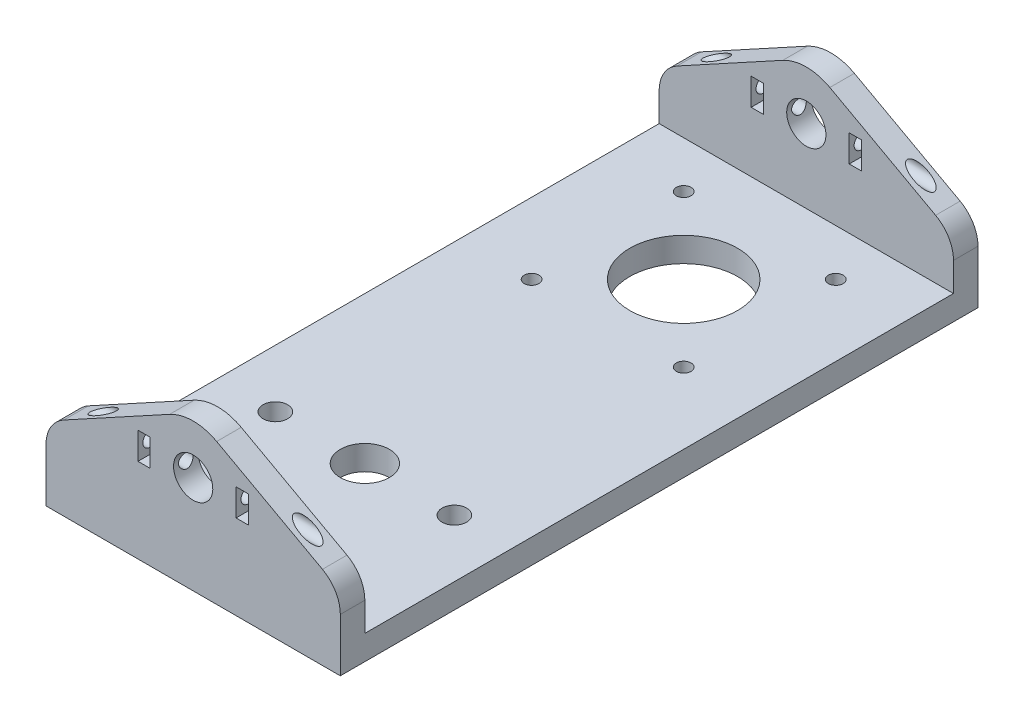
from build123d import *
from OCP.BRepAlgoAPI import BRepAlgoAPI_Cut
from OCP.TopTools import TopTools_ListOfShape

# Parameters (mm, degrees)
BOSS_EXTRUDE1_DEPTH    = 60
CUT_EXTRUDE1_START     = -130
CUT_EXTRUDE1_OUTLINE_R = 4
CUT_EXTRUDE1_OUTLINE_W = 2.5
CUT_EXTRUDE1_OUTLINE_H = 5.5
CUT_EXTRUDE1_DEPTH     = 130
CUT_EXTRUDE2_REACH     = 93.924
SKETCH3_R              = 11
SKETCH3_R_2            = 1.5
SKETCH3_R_3            = 5
SKETCH3_R_4            = 2.5
SKETCH4_R              = 1.5
CUT_EXTRUDE3_DEPTH     = 94.407708115


with BuildPart() as part:
    # Sketch1 → Boss-Extrude1 (new body)
    with BuildSketch(Plane(origin=(0, 0, 0), x_dir=(0, 0, -1), z_dir=(1, 0, 0))):
        Polygon((-65, 0), (65, 0), (65, 30), (60, 30), (60, 5), (-60, 5), (-60, 30), (-65, 30), align=None)
    extrude(amount=BOSS_EXTRUDE1_DEPTH)


with BuildPart() as cut_extrude1_tool:
    # Cut-Extrude1: read off the stored shape, not the designer's step
    # Cut-Extrude1 outline → Cut-Extrude1 (new body)
    with BuildSketch(Plane(origin=(0, 0, -65), x_dir=(-1, 0, 0), z_dir=(0, 0, -1)).offset(CUT_EXTRUDE1_START)):
        with BuildLine():
            Line((0, 30), (-30, 29.999998923))
            ThreePointArc((-30, 29.999998923), (-27.525092827, 29.688901535), (-25.204173103, 28.774965689))
            Line((-25.204173103, 28.774965689), (-3.642920811, 16.99098415))
            ThreePointArc((-3.642920811, 16.99098415), (-0.979221216, 14.419252925), (0, 10.848507507))
            Line((0, 10.848507507), (0, 30))
        make_face()
        with BuildLine():
            ThreePointArc((-60, 10.848507507), (-59.020778784, 14.419252925), (-56.357079189, 16.99098415))
            Line((-56.357079189, 16.99098415), (-34.795826897, 28.774965689))
            ThreePointArc((-34.795826897, 28.774965689), (-32.474907173, 29.688901535), (-30, 29.999998923))
            Line((-30, 29.999998923), (-60, 30))
            Line((-60, 30), (-60, 10.848507507))
        make_face()
        with Locations((-30, 20)):
            Circle(CUT_EXTRUDE1_OUTLINE_R)
        with Locations((-20, 20)):
            Rectangle(CUT_EXTRUDE1_OUTLINE_W, CUT_EXTRUDE1_OUTLINE_H)
        with Locations((-40, 20)):
            Rectangle(CUT_EXTRUDE1_OUTLINE_W, CUT_EXTRUDE1_OUTLINE_H)
    extrude(amount=CUT_EXTRUDE1_DEPTH)


with BuildPart() as part_1:
    add(part.part)

    # Cut-Extrude1: cut by cut_extrude1_tool, with a tolerance
    cut_extrude1_stock = TopTools_ListOfShape()
    cut_extrude1_stock.Append(part_1.part.wrapped)
    cut_extrude1_tools = TopTools_ListOfShape()
    cut_extrude1_tools.Append(cut_extrude1_tool.part.wrapped)
    cut_extrude1_cut = BRepAlgoAPI_Cut()
    cut_extrude1_cut.SetArguments(cut_extrude1_stock)
    cut_extrude1_cut.SetTools(cut_extrude1_tools)
    cut_extrude1_cut.SetFuzzyValue(0.00001)
    cut_extrude1_cut.Build()
    add(Compound.cast(cut_extrude1_cut.Shape()).solids(), mode=Mode.REPLACE)

    # Sketch3 → Cut-Extrude2 (cut, up to next)
    with BuildSketch(Plane(origin=(0, 5, 0), x_dir=(1, 0, 0), z_dir=(0, 1, 0)), mode=Mode.PRIVATE) as cut_extrude2_sk1:
        with Locations(Location((30, 35, 0), (0, 0, 270))):
            Circle(SKETCH3_R)
    cut_extrude2_tool1 = extrude(cut_extrude2_sk1.sketch, amount=-CUT_EXTRUDE2_REACH, mode=Mode.PRIVATE) & part_1.part
    # Sketch3 → Cut-Extrude2 (cut, up to next)
    with BuildSketch(Plane(origin=(0, 5, 0), x_dir=(1, 0, 0), z_dir=(0, 1, 0)), mode=Mode.PRIVATE) as cut_extrude2_sk2:
        with Locations(Location((45.5, 19.5, 0), (0, 0, 270))):
            Circle(SKETCH3_R_2)
    cut_extrude2_tool2 = extrude(cut_extrude2_sk2.sketch, amount=-CUT_EXTRUDE2_REACH, mode=Mode.PRIVATE) & part_1.part
    # Sketch3 → Cut-Extrude2 (cut, up to next)
    with BuildSketch(Plane(origin=(0, 5, 0), x_dir=(1, 0, 0), z_dir=(0, 1, 0)), mode=Mode.PRIVATE) as cut_extrude2_sk3:
        with Locations(Location((45.5, 50.5, 0), (0, 0, 270))):
            Circle(SKETCH3_R_2)
    cut_extrude2_tool3 = extrude(cut_extrude2_sk3.sketch, amount=-CUT_EXTRUDE2_REACH, mode=Mode.PRIVATE) & part_1.part
    # Sketch3 → Cut-Extrude2 (cut, up to next)
    with BuildSketch(Plane(origin=(0, 5, 0), x_dir=(1, 0, 0), z_dir=(0, 1, 0)), mode=Mode.PRIVATE) as cut_extrude2_sk4:
        with Locations(Location((14.5, 50.5, 0), (0, 0, 270))):
            Circle(SKETCH3_R_2)
    cut_extrude2_tool4 = extrude(cut_extrude2_sk4.sketch, amount=-CUT_EXTRUDE2_REACH, mode=Mode.PRIVATE) & part_1.part
    # Sketch3 → Cut-Extrude2 (cut, up to next)
    with BuildSketch(Plane(origin=(0, 5, 0), x_dir=(1, 0, 0), z_dir=(0, 1, 0)), mode=Mode.PRIVATE) as cut_extrude2_sk5:
        with Locations(Location((14.5, 19.5, 0), (0, 0, 270))):
            Circle(SKETCH3_R_2)
    cut_extrude2_tool5 = extrude(cut_extrude2_sk5.sketch, amount=-CUT_EXTRUDE2_REACH, mode=Mode.PRIVATE) & part_1.part
    # Sketch3 → Cut-Extrude2 (cut, up to next)
    with BuildSketch(Plane(origin=(0, 5, 0), x_dir=(1, 0, 0), z_dir=(0, 1, 0)), mode=Mode.PRIVATE) as cut_extrude2_sk6:
        with Locations(Location((30, -30, 0), (0, 0, 270))):
            Circle(SKETCH3_R_3)
    cut_extrude2_tool6 = extrude(cut_extrude2_sk6.sketch, amount=-CUT_EXTRUDE2_REACH, mode=Mode.PRIVATE) & part_1.part
    # Sketch3 → Cut-Extrude2 (cut, up to next)
    with BuildSketch(Plane(origin=(0, 5, 0), x_dir=(1, 0, 0), z_dir=(0, 1, 0)), mode=Mode.PRIVATE) as cut_extrude2_sk7:
        with Locations(Location((48.25, -30, 0), (0, 0, 270))):
            Circle(SKETCH3_R_4)
    cut_extrude2_tool7 = extrude(cut_extrude2_sk7.sketch, amount=-CUT_EXTRUDE2_REACH, mode=Mode.PRIVATE) & part_1.part
    # Sketch3 → Cut-Extrude2 (cut, up to next)
    with BuildSketch(Plane(origin=(0, 5, 0), x_dir=(1, 0, 0), z_dir=(0, 1, 0)), mode=Mode.PRIVATE) as cut_extrude2_sk8:
        with Locations(Location((11.75, -30, 0), (0, 0, 270))):
            Circle(SKETCH3_R_4)
    cut_extrude2_tool8 = extrude(cut_extrude2_sk8.sketch, amount=-CUT_EXTRUDE2_REACH, mode=Mode.PRIVATE) & part_1.part
    add(cut_extrude2_tool1.solids().sort_by_distance((30, 5, -35))[0], mode=Mode.SUBTRACT)
    add(cut_extrude2_tool2.solids().sort_by_distance((45.5, 5, -19.5))[0], mode=Mode.SUBTRACT)
    add(cut_extrude2_tool3.solids().sort_by_distance((45.5, 5, -50.5))[0], mode=Mode.SUBTRACT)
    add(cut_extrude2_tool4.solids().sort_by_distance((14.5, 5, -50.5))[0], mode=Mode.SUBTRACT)
    add(cut_extrude2_tool5.solids().sort_by_distance((14.5, 5, -19.5))[0], mode=Mode.SUBTRACT)
    add(cut_extrude2_tool6.solids().sort_by_distance((30, 5, 30))[0], mode=Mode.SUBTRACT)
    add(cut_extrude2_tool7.solids().sort_by_distance((48.25, 5, 30))[0], mode=Mode.SUBTRACT)
    add(cut_extrude2_tool8.solids().sort_by_distance((11.75, 5, 30))[0], mode=Mode.SUBTRACT)

    # Sketch4 → Cut-Extrude3 (cut, through all)
    with BuildSketch(Plane.ZY):
        with Locations((62.5, 20)):
            Circle(SKETCH4_R)
        with Locations((-62.5, 20)):
            Circle(SKETCH4_R)
    extrude(amount=-CUT_EXTRUDE3_DEPTH, mode=Mode.SUBTRACT)


solid = part_1.part
